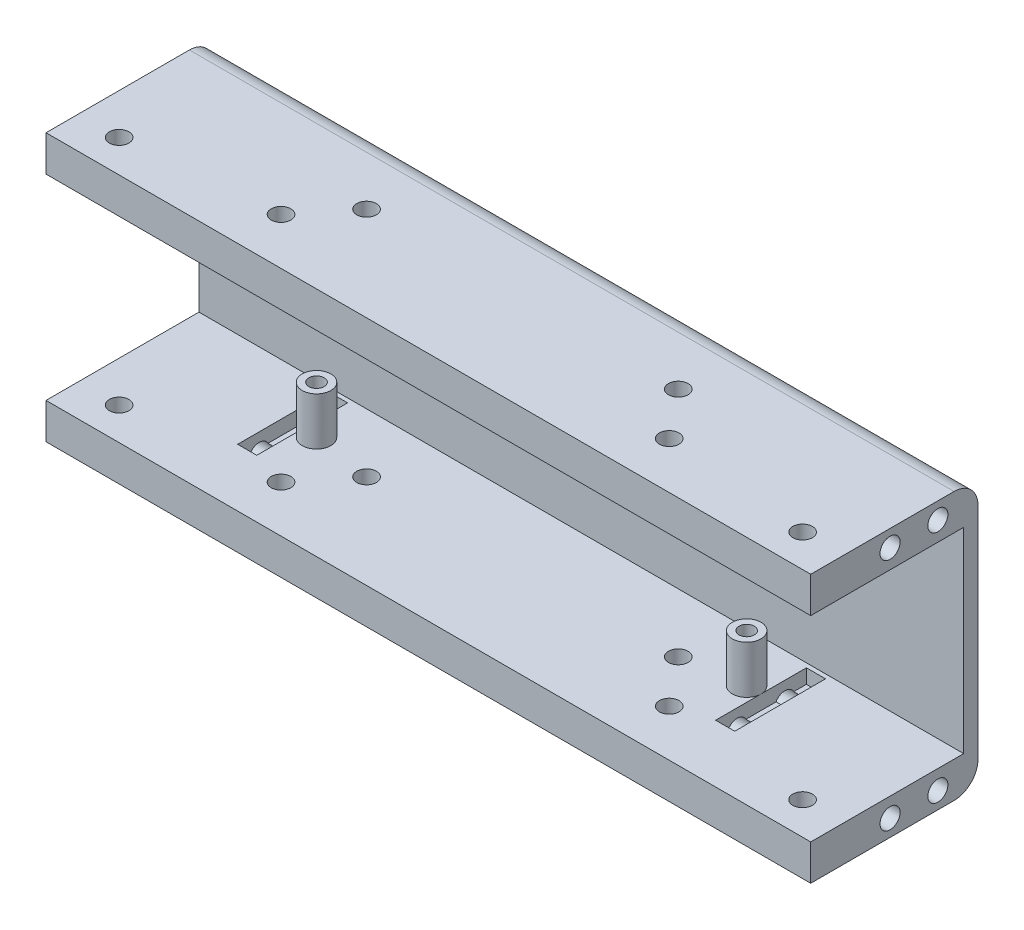
from build123d import *

# Parameters (mm, degrees)
SKETCH1_W               = 160
SKETCH1_H               = 56
BOSS_EXTRUDE1_DEPTH     = 35
SKETCH2_W               = 32
SKETCH2_H               = 41
CUT_EXTRUDE1_DEPTH      = 167.159561868
FILLET1_R               = 5
SKETCH6_W               = 4
SKETCH6_H               = 19
CUT_EXTRUDE4_DEPTH      = 3
MIRROR4_COPY_1_SKETCH_W = 4
MIRROR4_COPY_1_SKETCH_H = 19
MIRROR4_COPY_1_DEPTH    = 3
MIRROR4_COPY_2_SKETCH_W = 4
MIRROR4_COPY_2_SKETCH_H = 19
MIRROR4_COPY_2_DEPTH    = 3
SKETCH8_R               = 2.1
CUT_EXTRUDE6_DEPTH      = 167.159561868
SKETCH10_R              = 3
SKETCH10_R_2            = 1.5
BOSS_EXTRUDE3_DEPTH     = 10
SKETCH13_R              = 1.6
CUT_EXTRUDE9_DEPTH      = 96.431912901
SKETCH14_R              = 2.05
CUT_EXTRUDE10_DEPTH     = 104.735239914


with BuildPart() as part:
    # Sketch1 → Boss-Extrude1 (new body)
    with BuildSketch(Plane.XY):
        Rectangle(SKETCH1_W, SKETCH1_H)
    extrude(amount=BOSS_EXTRUDE1_DEPTH)

    # Sketch2 → Cut-Extrude1 (cut, through all)
    with BuildSketch(Plane.ZY.offset(80)):
        with Locations((19, 0)):
            Rectangle(SKETCH2_W, SKETCH2_H)
    extrude(amount=-CUT_EXTRUDE1_DEPTH, mode=Mode.SUBTRACT)

    # Fillet1
    fillet1_edges = [part.edges().sort_by_distance(p)[0] for p in [
        (0, -28, 0),
        (0, 28, 0),
    ]]
    fillet(fillet1_edges, radius=FILLET1_R)

    # Sketch6 → Cut-Extrude4 (cut)
    with BuildSketch(Plane.XZ.offset(-20.5)):
        with Locations((-50, 13.4)):
            Rectangle(SKETCH6_W, SKETCH6_H)
    cut_extrude4 = extrude(amount=-CUT_EXTRUDE4_DEPTH, mode=Mode.SUBTRACT)

    # Mirror3: Cut-Extrude4 across plane
    add(cut_extrude4.mirror(Plane.ZY), mode=Mode.SUBTRACT)

    # Mirror4 copy 1 sketch → Mirror4 copy 1 (cut)
    with BuildSketch(Plane(origin=(0, -20.5, 0), x_dir=(-1, 0, 0), z_dir=(0, 1, 0))):
        with Locations((-50, 13.4)):
            Rectangle(MIRROR4_COPY_1_SKETCH_W, MIRROR4_COPY_1_SKETCH_H)
    extrude(amount=-MIRROR4_COPY_1_DEPTH, mode=Mode.SUBTRACT)

    # Mirror4 copy 2 sketch → Mirror4 copy 2 (cut)
    with BuildSketch(Plane(origin=(0, -20.5, 0), x_dir=(1, 0, 0), z_dir=(0, 1, 0))):
        with Locations((-50, -13.4)):
            Rectangle(MIRROR4_COPY_2_SKETCH_W, MIRROR4_COPY_2_SKETCH_H)
    extrude(amount=-MIRROR4_COPY_2_DEPTH, mode=Mode.SUBTRACT)

    # Sketch8 → Cut-Extrude6 (cut, through all)
    with BuildSketch(Plane.ZY.offset(80)):
        with Locations((18.4, -24.5)):
            Circle(SKETCH8_R)
        with Locations((8.4, -24.5)):
            Circle(SKETCH8_R)
    cut_extrude6 = extrude(amount=-CUT_EXTRUDE6_DEPTH, mode=Mode.SUBTRACT)

    # Mirror5: Cut-Extrude6 across plane
    add(cut_extrude6.mirror(Plane.ZX), mode=Mode.SUBTRACT)

    # Sketch10 → Boss-Extrude3 (add)
    with BuildSketch(Plane(origin=(0, -20.5, 0), x_dir=(1, 0, 0), z_dir=(0, 1, 0))):
        with Locations((-45, -13.4)):
            Circle(SKETCH10_R)
        with Locations((-45, -13.4)):
            Circle(SKETCH10_R_2, mode=Mode.SUBTRACT)
    boss_extrude3 = extrude(amount=BOSS_EXTRUDE3_DEPTH)

    # Sketch13 → Cut-Extrude9 (cut, through all)
    with BuildSketch(Plane(origin=(0, -10.5, 0), x_dir=(1, 0, 0), z_dir=(0, 1, 0))):
        with Locations((-45, -13.4)):
            Circle(SKETCH13_R)
    cut_extrude9 = extrude(amount=-CUT_EXTRUDE9_DEPTH, mode=Mode.SUBTRACT)

    # Mirror6: Boss-Extrude3, Cut-Extrude9 across plane
    add(boss_extrude3.mirror(Plane.ZY))
    add(cut_extrude9.mirror(Plane.ZY), mode=Mode.SUBTRACT)

    # Sketch14 → Cut-Extrude10 (cut, through all)
    with BuildSketch(Plane(origin=(0, 28, 0), x_dir=(1, 0, 0), z_dir=(0, 1, 0))):
        with Locations((-71.503622925, -28.203284125)):
            Circle(SKETCH14_R)
        with Locations((-40.610108981, -25.216075278)):
            Circle(SKETCH14_R)
        with Locations((-32.61010904, -15.320010713)):
            Circle(SKETCH14_R)
        with Locations((71.503622925, -28.203284125)):
            Circle(SKETCH14_R)
        with Locations((40.610108981, -25.216075278)):
            Circle(SKETCH14_R)
        with Locations((32.61010904, -15.320010713)):
            Circle(SKETCH14_R)
        with Locations((40.610108981, -91.583924722)):
            Circle(SKETCH14_R)
        with Locations((71.503622925, -88.596715875)):
            Circle(SKETCH14_R)
        with Locations((32.61010904, -101.479989287)):
            Circle(SKETCH14_R)
        with Locations((-32.61010904, -101.479989287)):
            Circle(SKETCH14_R)
        with Locations((-40.610108981, -91.583924722)):
            Circle(SKETCH14_R)
        with Locations((-71.503622925, -88.596715875)):
            Circle(SKETCH14_R)
    extrude(amount=-CUT_EXTRUDE10_DEPTH, mode=Mode.SUBTRACT)


solid = part.part
